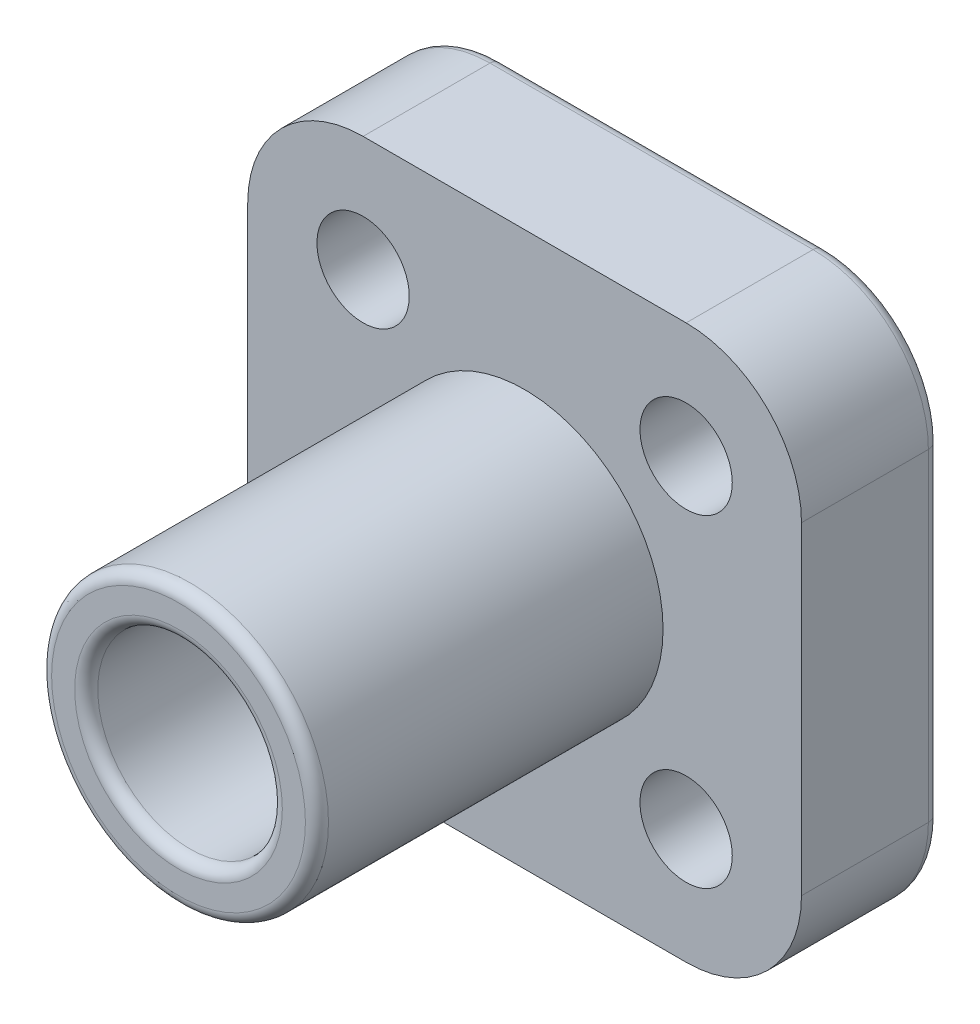
from build123d import *

# Parameters (mm, degrees)
ESQUISSE1_R             = 2
BOSS_EXTRU_1_DEPTH      = 6
ESQUISSE2_R             = 6
ESQUISSE2_R_2           = 4
BOSS_EXTRU_2_DEPTH      = 15
ENL_V_MAT_EXTRU_1_REACH = 24.65
ESQUISSE3_R             = 4
CONG_1_R                = 0.5


with BuildPart() as part:
    # Esquisse1 → Boss.-Extru.1 (new body)
    with BuildSketch(Plane.XY):
        with BuildLine():
            Line((7, -12), (-7, -12))
            ThreePointArc((-7, -12), (-10.535533906, -10.535533906), (-12, -7))
            Line((-12, -7), (-12, 7))
            ThreePointArc((-12, 7), (-10.535533906, 10.535533906), (-7, 12))
            Line((-7, 12), (7, 12))
            ThreePointArc((7, 12), (10.535533906, 10.535533906), (12, 7))
            Line((12, 7), (12, -7))
            ThreePointArc((12, -7), (10.535533906, -10.535533906), (7, -12))
        make_face()
        with Locations((-7, 7)):
            Circle(ESQUISSE1_R, mode=Mode.SUBTRACT)
        with Locations((7, 7)):
            Circle(ESQUISSE1_R, mode=Mode.SUBTRACT)
        with Locations((7, -7)):
            Circle(ESQUISSE1_R, mode=Mode.SUBTRACT)
        with Locations((-7, -7)):
            Circle(ESQUISSE1_R, mode=Mode.SUBTRACT)
    extrude(amount=BOSS_EXTRU_1_DEPTH)

    # Esquisse2 → Boss.-Extru.2 (add)
    with BuildSketch(Plane.XY.offset(6)):
        Circle(ESQUISSE2_R)
        Circle(ESQUISSE2_R_2, mode=Mode.SUBTRACT)
    extrude(amount=BOSS_EXTRU_2_DEPTH)

    # Esquisse3 → Enlèv. mat.-Extru.1 (cut, up to next)
    with BuildSketch(Plane.XY.offset(6), mode=Mode.PRIVATE) as enl_v_mat_extru_1_sk1:
        Circle(ESQUISSE3_R)
    enl_v_mat_extru_1_tool1 = extrude(enl_v_mat_extru_1_sk1.sketch, amount=-ENL_V_MAT_EXTRU_1_REACH, mode=Mode.PRIVATE) & part.part
    add(enl_v_mat_extru_1_tool1.solids().sort_by_distance((0, 0, 6))[0], mode=Mode.SUBTRACT)

    # Congé1
    cong_1_edges = [part.edges().sort_by_distance(p)[0] for p in [
        (-6, 0, 21),
        (-4, 0, 21),
        (-9, -7, 0),
        (5, -7, 0),
        (5, 7, 0),
        (-9, 7, 0),
        (12, 0, 0),
        (10.535533906, 10.535533906, 0),
        (0, 12, 0),
        (-10.535533906, 10.535533906, 0),
        (-12, 0, 0),
        (-10.535533906, -10.535533906, 0),
        (0, -12, 0),
        (10.535533906, -10.535533906, 0),
        (-4, 0, 0),
    ]]
    fillet(cong_1_edges, radius=CONG_1_R)


solid = part.part
